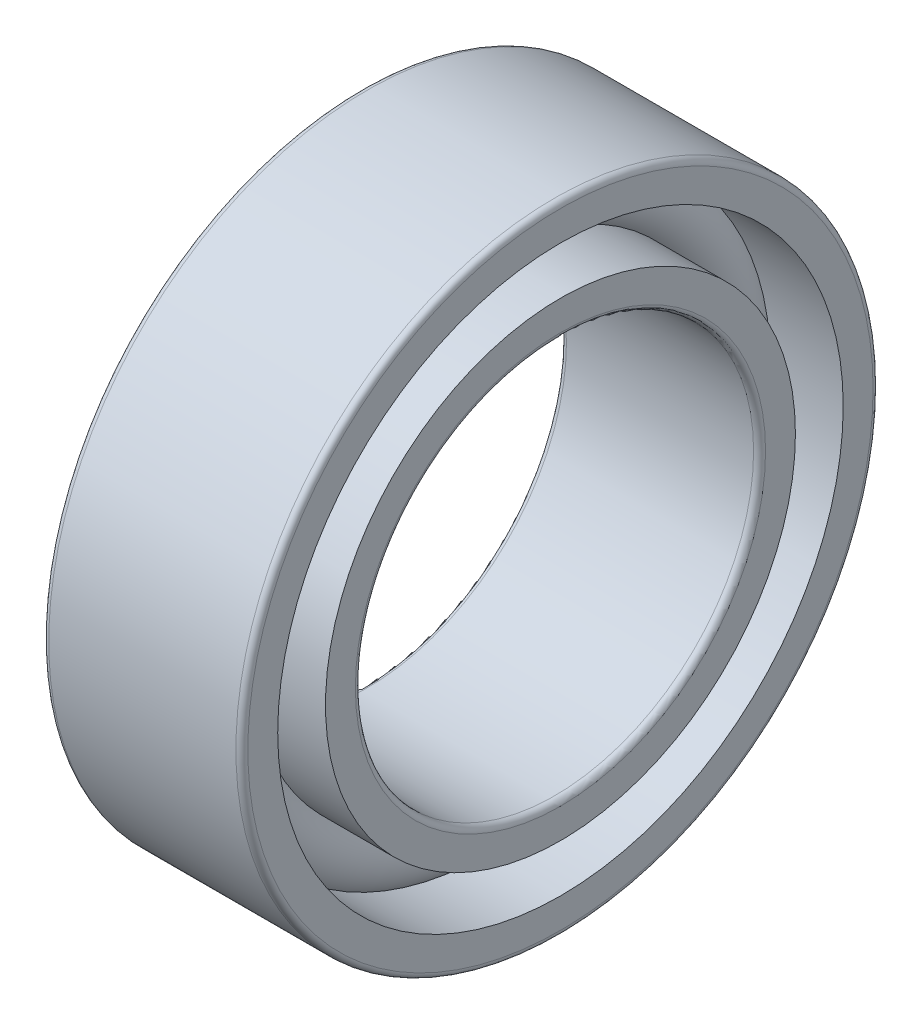
from build123d import *

# Parameters (mm, degrees)
CAGSPISKE_W     = 0.36
CAGSPISKE_H     = 0.6
CAGESPINE_ANGLE = 0.001
BALSIMSKE_R     = 1.8


with BuildPart() as part:
    # CagSpiSke → CageSpine (revolve)
    with BuildSketch(Plane.XY):
        with Locations((0, 13)):
            Rectangle(CAGSPISKE_W, CAGSPISKE_H)
    revolve(axis=Axis((-20.6375, 0, 0), (-1, 0, 0)), revolution_arc=CAGESPINE_ANGLE)

    # BalSimSke → BallsSimplified (revolve)
    with BuildSketch(Plane.XY):
        with Locations((0, 13)):
            Circle(BALSIMSKE_R)
    revolve(axis=Axis((-10, 0, 0), (1, 0, 0)))

    # InnRacSke → InnerRace (revolve)
    with BuildSketch(Plane.XY):
        with BuildLine():
            Line((-1.307908636, 11.8), (-5, 11.8))
            Line((-5, 11.8), (-5, 10.3))
            ThreePointArc((-5, 10.3), (-4.912132034, 10.087867966), (-4.7, 10))
            Line((-4.7, 10), (4.7, 10))
            ThreePointArc((4.7, 10), (4.912132034, 10.087867966), (5, 10.3))
            Line((5, 10.3), (5, 11.8))
            Line((5, 11.8), (1.307908636, 11.8))
            ThreePointArc((1.307908636, 11.8), (0, 11.225), (-1.307908636, 11.8))
        make_face()
    revolve(axis=Axis((-20.6375, 0, 0), (1, 0, 0)))

    # OutRacSke → OuterRace (revolve)
    with BuildSketch(Plane.XY):
        with BuildLine():
            Line((-1.307908636, 14.2), (-5, 14.2))
            Line((-5, 14.2), (-5, 15.7))
            ThreePointArc((-5, 15.7), (-4.912132034, 15.912132034), (-4.7, 16))
            Line((-4.7, 16), (4.7, 16))
            ThreePointArc((4.7, 16), (4.912132034, 15.912132034), (5, 15.7))
            Line((5, 15.7), (5, 14.2))
            Line((5, 14.2), (1.307908636, 14.2))
            ThreePointArc((1.307908636, 14.2), (0, 14.775), (-1.307908636, 14.2))
        make_face()
    revolve(axis=Axis((-20.6375, 0, 0), (1, 0, 0)))


solid = part.part
